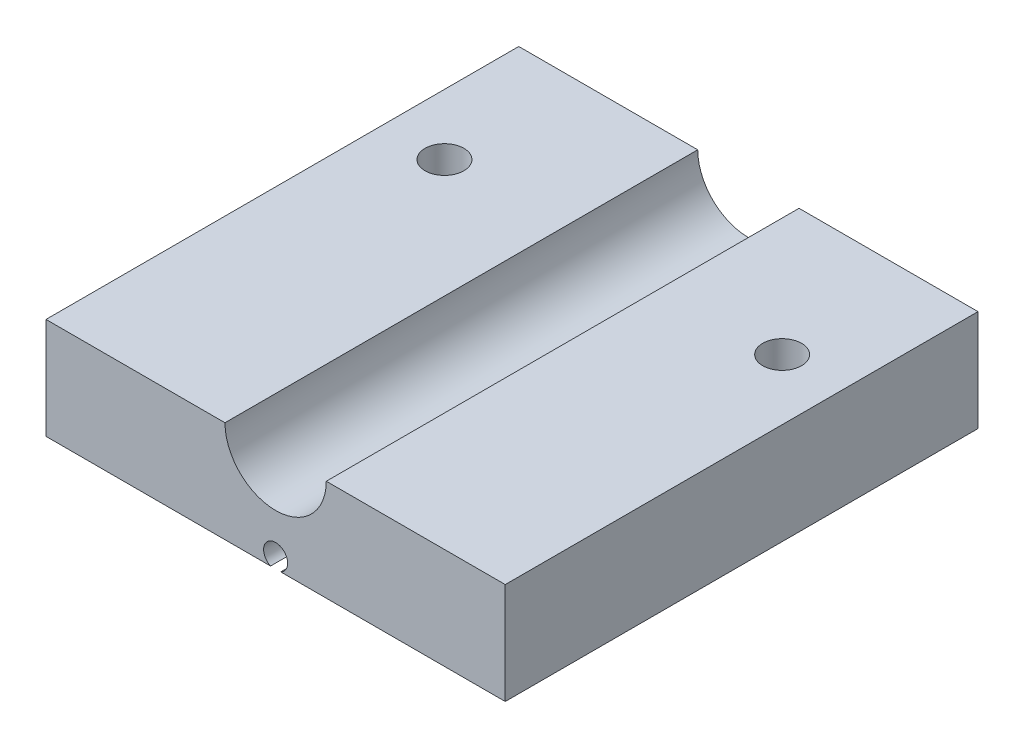
from build123d import *

# Parameters (mm, degrees)
SKETCH1_W                                      = 43.18
SKETCH1_H                                      = 44.45
BOSS_EXTRUDE1_DEPTH                            = 9.525
SKETCH4_R                                      = 4.7625
CUT_EXTRUDE1_DEPTH                             = 51.32550273
MOTORHOLES_D                                   = 2.2606
MOTORHOLES_DEPTH                               = 6.35
MOTORHOLES_TIP                                 = 0.679152758
CBORE_FOR_6_SOCKET_HEAD_CAP_SCREW1_D           = 3.6576
CBORE_FOR_6_SOCKET_HEAD_CAP_SCREW1_CBORE_D     = 7.14502
CBORE_FOR_6_SOCKET_HEAD_CAP_SCREW1_CBORE_DEPTH = 3.5052
F_4_40_TAPPED_HOLE2_D                          = 2.2606
F_4_40_TAPPED_HOLE2_DEPTH                      = 7.62
F_4_40_TAPPED_HOLE2_TIP                        = 0.679152758


with BuildPart() as part:
    # Sketch1 → Boss-Extrude1 (new body)
    with BuildSketch(Plane(origin=(0, 0, 0), x_dir=(1, 0, 0), z_dir=(0, 1, 0))):
        Rectangle(SKETCH1_W, SKETCH1_H)
    extrude(amount=BOSS_EXTRUDE1_DEPTH)

    # Sketch4 → Cut-Extrude1 (cut, through all)
    with BuildSketch(Plane.XY.offset(22.225)):
        with Locations((0, 9.525)):
            Circle(SKETCH4_R)
    extrude(amount=-CUT_EXTRUDE1_DEPTH, mode=Mode.SUBTRACT)

    # MotorHoles
    with Locations(Plane(origin=(0, 0, 0), x_dir=(-1, 0, 0), z_dir=(0, -1, 0))):
        with Locations((-5.715, -19.05), (5.715, -19.05), (13.081, 19.9644), (-13.081, 19.9644)):
            Hole(MOTORHOLES_D / 2, depth=MOTORHOLES_DEPTH)
            with Locations((0, 0, -(MOTORHOLES_DEPTH + MOTORHOLES_TIP / 2))):  # 118° drill point
                Cone(0, MOTORHOLES_D / 2, MOTORHOLES_TIP, mode=Mode.SUBTRACT)

    # CBORE for #6 Socket Head Cap Screw1 (through all)
    with Locations(Plane(origin=(0, 0, 0), x_dir=(-1, 0, 0), z_dir=(0, -1, 0))):
        with Locations((-15.875, 9.525), (15.875, 9.525)):
            CounterBoreHole(CBORE_FOR_6_SOCKET_HEAD_CAP_SCREW1_D / 2, CBORE_FOR_6_SOCKET_HEAD_CAP_SCREW1_CBORE_D / 2, CBORE_FOR_6_SOCKET_HEAD_CAP_SCREW1_CBORE_DEPTH)

    # #4-40 Tapped Hole2
    with Locations(Plane.XY.offset(22.225)):
        with Locations((0, 1.025)):
            Hole(F_4_40_TAPPED_HOLE2_D / 2, depth=F_4_40_TAPPED_HOLE2_DEPTH)
            with Locations((0, 0, -(F_4_40_TAPPED_HOLE2_DEPTH + F_4_40_TAPPED_HOLE2_TIP / 2))):  # 118° drill point
                Cone(0, F_4_40_TAPPED_HOLE2_D / 2, F_4_40_TAPPED_HOLE2_TIP, mode=Mode.SUBTRACT)


solid = part.part
